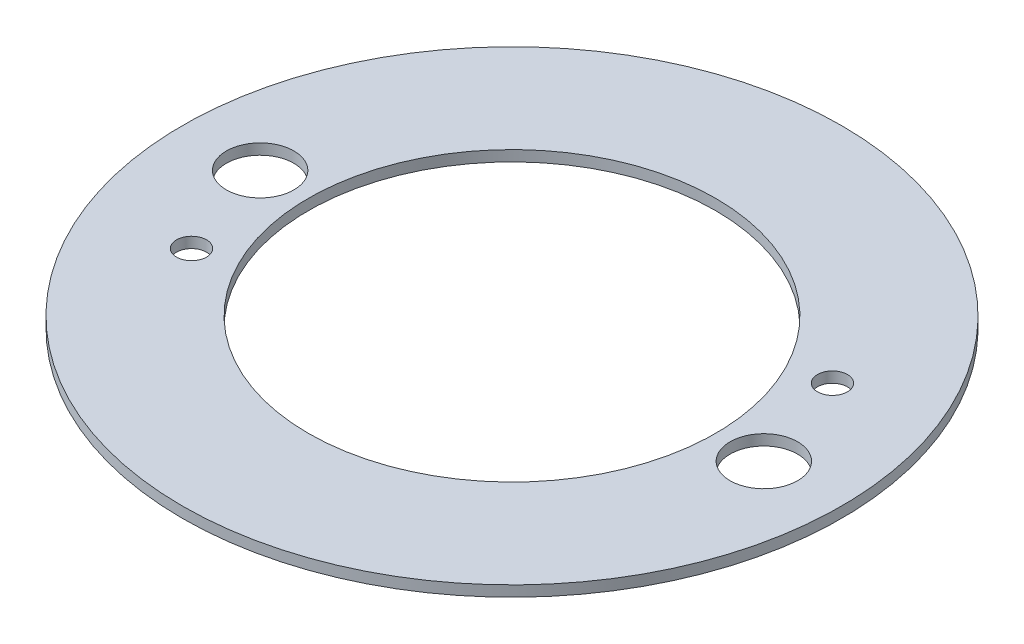
from build123d import *

# Parameters (mm, degrees)
SKETCH1_R           = 78.105
SKETCH1_R_2         = 48.26
BOSS_EXTRUDE1_DEPTH = 2.54
SKETCH2_R           = 8.001
SKETCH2_R_2         = 3.556
CUT_EXTRUDE1_DEPTH  = 2.54


with BuildPart() as part:
    # Sketch1 → Boss-Extrude1 (new body)
    with BuildSketch(Plane(origin=(0, 0, 0), x_dir=(1, 0, 0), z_dir=(0, 1, 0))):
        Circle(SKETCH1_R)
        Circle(SKETCH1_R_2, mode=Mode.SUBTRACT)
    extrude(amount=BOSS_EXTRUDE1_DEPTH)

    # Sketch2 → Cut-Extrude1 (cut)
    with BuildSketch(Plane(origin=(0, 2.54, 0), x_dir=(1, 0, 0), z_dir=(0, 1, 0))):
        with Locations((-59.69, 0)):
            Circle(SKETCH2_R)
        with Locations((59.69, 0)):
            Circle(SKETCH2_R)
        with Locations((-51.795490029, -24.152633658)):
            Circle(SKETCH2_R_2)
        with Locations((51.795490029, 24.152633658)):
            Circle(SKETCH2_R_2)
    extrude(amount=-CUT_EXTRUDE1_DEPTH, mode=Mode.SUBTRACT)


solid = part.part
